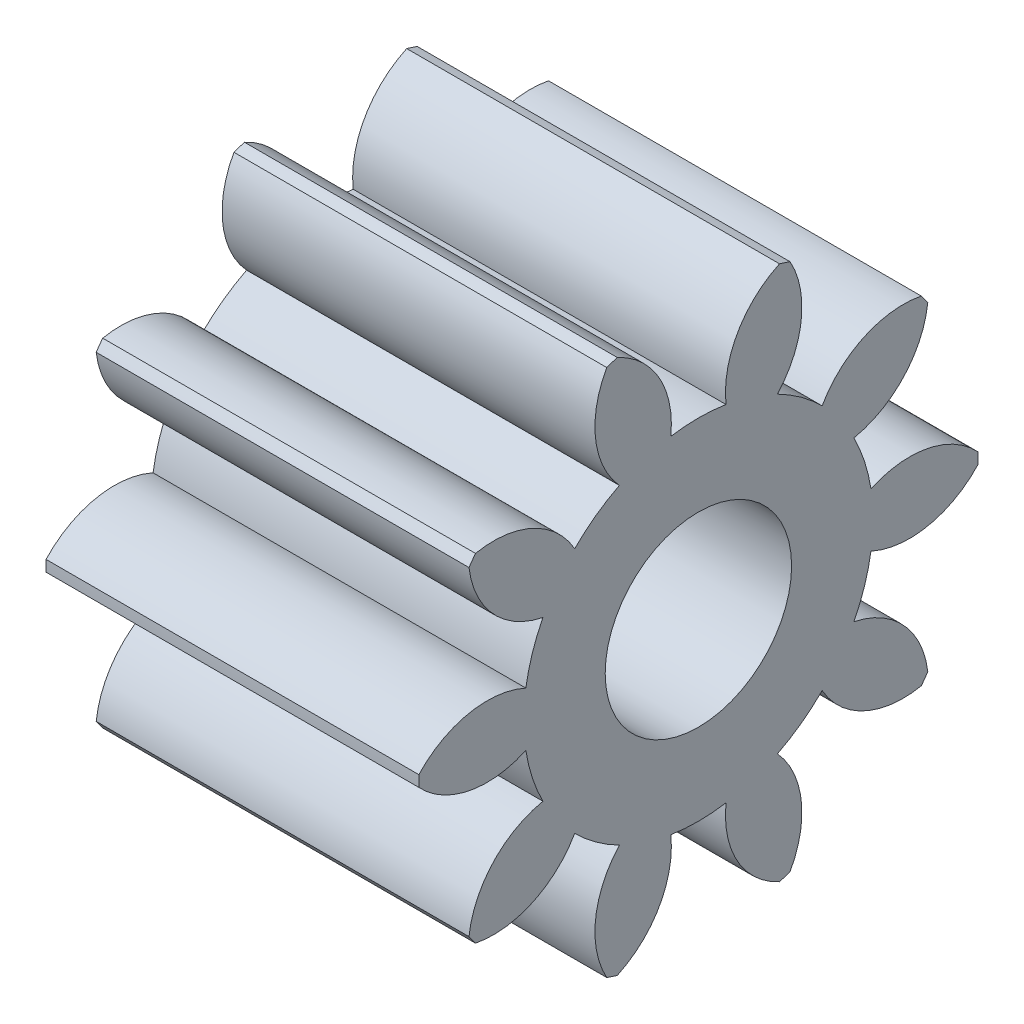
from build123d import *

# Parameters (mm, degrees)
BASPROSKE_W     = 4
BASPROSKE_H     = 3
TOOTHCUT_DEPTH  = 6.830951895
TEETHCUTS_COUNT = 10
TEETHCUTS_ANGLE = 324
BORSKE_R        = 1
BORE_DEPTH      = 50.0000508


with BuildPart() as part:
    # BasProSke → Base-Revolve (revolve)
    with BuildSketch(Plane(origin=(0, 0, 0), x_dir=(1, 0, 0), z_dir=(0, 1, 0))):
        with Locations((2, 1.5)):
            Rectangle(BASPROSKE_W, BASPROSKE_H)
    revolve(axis=Axis((-10, 0, 0), (1, 0, 0)))

    # TooCutSke → ToothCut (cut, through all)
    with BuildSketch(Plane(origin=(0, 0, 0), x_dir=(0, 0, -1), z_dir=(1, 0, 0))):
        with BuildLine():
            ThreePointArc((0.296449938, 1.850403587), (0, 1.874), (-0.296449938, 1.850403587))
            ThreePointArc((-0.296449938, 1.850403587), (-0.428089565, 2.470295585), (-0.905889751, 2.886591228))
            ThreePointArc((-0.905889751, 2.886591228), (0, 3.0254), (0.905889751, 2.886591228))
            ThreePointArc((0.905889751, 2.886591228), (0.428089565, 2.470295585), (0.296449938, 1.850403587))
        make_face()
    toothcut = extrude(amount=TOOTHCUT_DEPTH, mode=Mode.SUBTRACT)

    # TeethCuts: ToothCut ×10 about axis
    teethcuts_axis = Axis((-10, 0, 0), (1, 0, 0))
    for i in range(1, TEETHCUTS_COUNT):
        add(toothcut.rotate(teethcuts_axis, i * TEETHCUTS_ANGLE / (TEETHCUTS_COUNT - 1)), mode=Mode.SUBTRACT)

    # BorSke → Bore (cut, symmetric)
    with BuildSketch(Plane(origin=(0, 0, 0), x_dir=(0, 0, -1), z_dir=(1, 0, 0))):
        Circle(BORSKE_R)
    extrude(amount=BORE_DEPTH, both=True, mode=Mode.SUBTRACT)


solid = part.part
